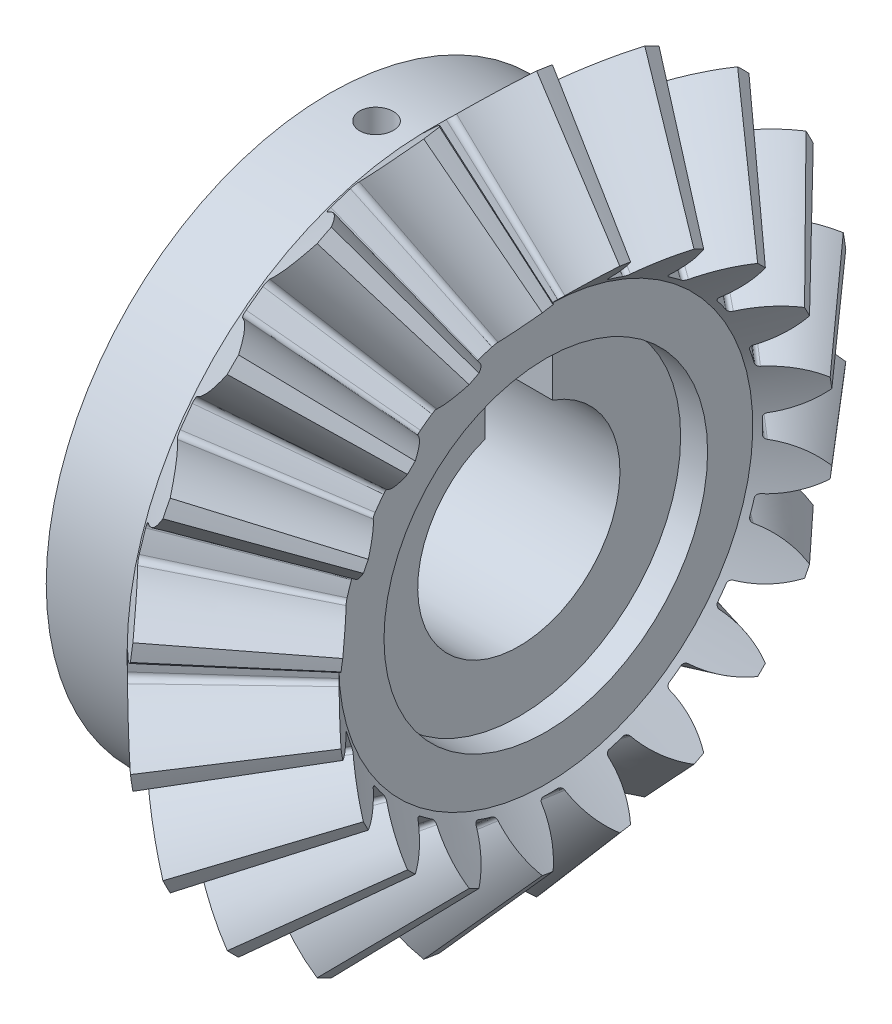
from build123d import *

# Parameters (mm, degrees)
TEETHCUTS_COUNT           = 20
TEETHCUTS_ANGLE           = 342
HUBSKE_R                  = 21
HUB_DEPTH                 = 7.374083791
BORSKE_R                  = 7
BORE_DEPTH                = 35.0000508
KEYSKE_W                  = 5
KEYSKE_H                  = 9.3
KEYWAY_DEPTH              = 35.0000508
SKETCH1_W                 = 5
SKETCH1_H                 = 0.7
CUT_EXTRUDE1_DEPTH        = 41.799524734
M3X0_5_TAPPED_HOLE1_D     = 2.5
M3X0_5_TAPPED_HOLE1_DEPTH = 11
SKETCH5_R                 = 12
CUT_EXTRUDE2_DEPTH        = 2


with BuildPart() as part:
    # BasProSke → Base-Revolve (revolve)
    with BuildSketch(Plane(origin=(0, 0, 0), x_dir=(1, 0, 0), z_dir=(0, 1, 0)), mode=Mode.PRIVATE) as base_revolve_sk:
        Polygon((0, 0), (0, 22.373982194), (4.393784766, 26.767766951), (11.687670029, 18.363881673), (8.673337766, 15.349549416), (8.673337766, 0), align=None)
    revolve(base_revolve_sk.sketch.rotate(Axis((-10, 0, 0), (1, 0, 0)), 180), axis=Axis((-10, 0, 0), (1, 0, 0)))

    # ToothCut: read off the stored shape, not the designer's step
    # ToothCut: loft between two sections, ruled curve by curve
    toothcut_from = [
        Edge.make_bspline([(27.632061775, 0.006043964, -0.009393107), (27.627836962, 0.001819151, -0.01483001), (27.622153271, -0.00386454, -0.014024229), (27.618775653, -0.007242158, -0.007509524)], [0, 0, 0, 0, 1, 1, 1, 1], 3, [1, 0.77919554, 0.77919554, 1]),
        Edge.make_bspline([(27.618775653, -0.007242158, 0.007509524), (27.622153271, -0.00386454, 0.014024229), (27.627836962, 0.001819151, 0.01483001), (27.632061775, 0.006043964, 0.009393107)], [0, 0, 0, 0, 1, 1, 1, 1], 3, [1, 0.77919554, 0.77919554, 1]),
        Edge.make_bspline([(27.618775653, -0.007242158, -0.007509524), (27.618275945, -0.007741866, -0.006545694), (27.617876746, -0.008141065, -0.005492289), (27.617585944, -0.008431867, -0.004370125)], [0, 0, 0, 0, 1, 1, 1, 1], 3, [1, 0.993412679, 0.993412679, 1]),
        Edge.make_bspline([(27.617585944, -0.008431867, 0.004370125), (27.617876746, -0.008141065, 0.005492289), (27.618275945, -0.007741866, 0.006545694), (27.618775653, -0.007242158, 0.007509524)], [0, 0, 0, 0, 1, 1, 1, 1], 3, [1, 0.993412679, 0.993412679, 1]),
        Edge.make_bspline([(27.617585944, -0.008431867, -0.004370125), (27.61684697, -0.009170841, -0.001518531), (27.61684697, -0.009170841, 0.001518531), (27.617585944, -0.008431867, 0.004370125)], [0, 0, 0, 0, 1, 1, 1, 1], 3, [1, 0.959287609, 0.959287609, 1]),
        Edge.make_line((27.632061775, 0.006043964, 0.009393107), (27.632061775, 0.006043964, -0.009393107)),
    ]
    toothcut_to = [
        Edge.make_bspline([(4.57837287, 26.952355056, -4.015814914), (3.539433303, 25.91341549, -2.552366841), (2.236900352, 24.610882542, -1.599850731), (0.791930966, 23.165913159, -1.246866219)], [0, 0, 0, 0, 1, 1, 1, 1], 3, [1, 0.968994528, 0.968994528, 1]),
        Edge.make_bspline([(0.791930966, 23.165913159, 1.246866219), (2.236900352, 24.610882542, 1.599850731), (3.539433303, 25.91341549, 2.552366841), (4.57837287, 26.952355056, 4.015814914)], [0, 0, 0, 0, 1, 1, 1, 1], 3, [1, 0.968994528, 0.968994528, 1]),
        Edge.make_bspline([(0.791930966, 23.165913159, -1.246866219), (0.61984468, 22.993826873, -1.204828101), (0.509699618, 22.883681811, -1.013175515), (0.515774885, 22.889757078, -0.766354192)], [0, 0, 0, 0, 1, 1, 1, 1], 3, [1, 0.835734487, 0.835734487, 1]),
        Edge.make_bspline([(0.515774885, 22.889757078, 0.766354192), (0.509699618, 22.883681811, 1.013175515), (0.61984468, 22.993826873, 1.204828101), (0.791930966, 23.165913159, 1.246866219)], [0, 0, 0, 0, 1, 1, 1, 1], 3, [1, 0.835734487, 0.835734487, 1]),
        Edge.make_bspline([(0.515774885, 22.889757078, -0.766354192), (0.528347723, 22.902329916, -0.255554522), (0.528347723, 22.902329916, 0.255554522), (0.515774885, 22.889757078, 0.766354192)], [0, 0, 0, 0, 1, 1, 1, 1], 3, [1, 0.999596466, 0.999596466, 1]),
        Edge.make_line((4.57837287, 26.952355056, 4.015814914), (4.57837287, 26.952355056, -4.015814914)),
    ]
    toothcut = Solid(Shell([*[Face.make_surface_from_curves(toothcut_from[k], toothcut_to[k]) for k in range(6)], Face(Wire(toothcut_from)), Face(Wire(toothcut_to))]))
    add(toothcut, mode=Mode.SUBTRACT)

    # TeethCuts: ToothCut ×20 about axis
    teethcuts_axis = Axis((-10, 0, 0), (1, 0, 0))
    for i in range(1, TEETHCUTS_COUNT):
        add(toothcut.rotate(teethcuts_axis, i * TEETHCUTS_ANGLE / (TEETHCUTS_COUNT - 1)), mode=Mode.SUBTRACT)

    # HubSke → Hub (add)
    with BuildSketch(Plane.ZY):
        with Locations(Location((0, 0, 0), (0, 0, 180))):
            Circle(HUBSKE_R)
    extrude(amount=HUB_DEPTH)

    # BorSke → Bore (cut, symmetric)
    with BuildSketch(Plane(origin=(0, 0, 0), x_dir=(0, 0, -1), z_dir=(1, 0, 0))):
        with Locations(Location((0, 0, 0), (0, 0, 180))):
            Circle(BORSKE_R)
    extrude(amount=BORE_DEPTH, both=True, mode=Mode.SUBTRACT)

    # KeySke → Keyway (cut, symmetric)
    with BuildSketch(Plane(origin=(0, 0, 0), x_dir=(0, 0, -1), z_dir=(1, 0, 0))):
        with Locations((0, 4.65)):
            Rectangle(KEYSKE_W, KEYSKE_H)
    extrude(amount=KEYWAY_DEPTH, both=True, mode=Mode.SUBTRACT)

    # Sketch1 → Cut-Extrude1 (cut, through all)
    with BuildSketch(Plane(origin=(8.673337766, 0, 0), x_dir=(0, 0, -1), z_dir=(1, 0, 0))):
        with BuildLine():
            Line((2.5, 5), (-2.5, 5))
            Line((-2.5, 5), (-2.5, 6.538348415))
            ThreePointArc((-2.5, 6.538348415), (0, -7), (2.5, 6.538348415))
            Line((2.5, 6.538348415), (2.5, 5))
        make_face()
        with BuildLine():
            Line((-2.5, 6.538348415), (-2.5, 5))
            Line((-2.5, 5), (2.5, 5))
            Line((2.5, 5), (2.5, 6.538348415))
            Line((2.5, 6.538348415), (2.5, 7.071067812))
            ThreePointArc((2.5, 7.071067812), (0, 7.5), (-2.5, 7.071067812))
            Line((-2.5, 7.071067812), (-2.5, 6.538348415))
        make_face()
        with Locations((0, 9.65)):
            Rectangle(SKETCH1_W, SKETCH1_H)
        with BuildLine():
            Line((-2.5, 9.3), (-2.5, 7.071067812))
            ThreePointArc((-2.5, 7.071067812), (0, 7.5), (2.5, 7.071067812))
            Line((2.5, 7.071067812), (2.5, 9.3))
            Line((2.5, 9.3), (-2.5, 9.3))
        make_face()
        with BuildLine():
            ThreePointArc((2.5, 6.538348415), (0, -7), (-2.5, 6.538348415))
            Line((-2.5, 6.538348415), (-2.5, 7.071067812))
            ThreePointArc((-2.5, 7.071067812), (-4.330127019, -6.123724357), (7.5, 0))
            ThreePointArc((7.5, 0), (6.123724357, 4.330127019), (2.5, 7.071067812))
            Line((2.5, 7.071067812), (2.5, 6.538348415))
        make_face()
    extrude(amount=-CUT_EXTRUDE1_DEPTH, mode=Mode.SUBTRACT)

    # M3x0.5 Tapped Hole1
    with Locations(Plane(origin=(0, 21, 0), x_dir=(1, 0, 0), z_dir=(0, 1, 0))):
        with Locations((-3.874083791, 0)):
            Hole(M3X0_5_TAPPED_HOLE1_D / 2, depth=M3X0_5_TAPPED_HOLE1_DEPTH)

    # Sketch5 → Cut-Extrude2 (cut)
    with BuildSketch(Plane(origin=(8.673337766, 0, 0), x_dir=(0, 0, -1), z_dir=(1, 0, 0))):
        Circle(SKETCH5_R)
    extrude(amount=-CUT_EXTRUDE2_DEPTH, mode=Mode.SUBTRACT)


solid = part.part
